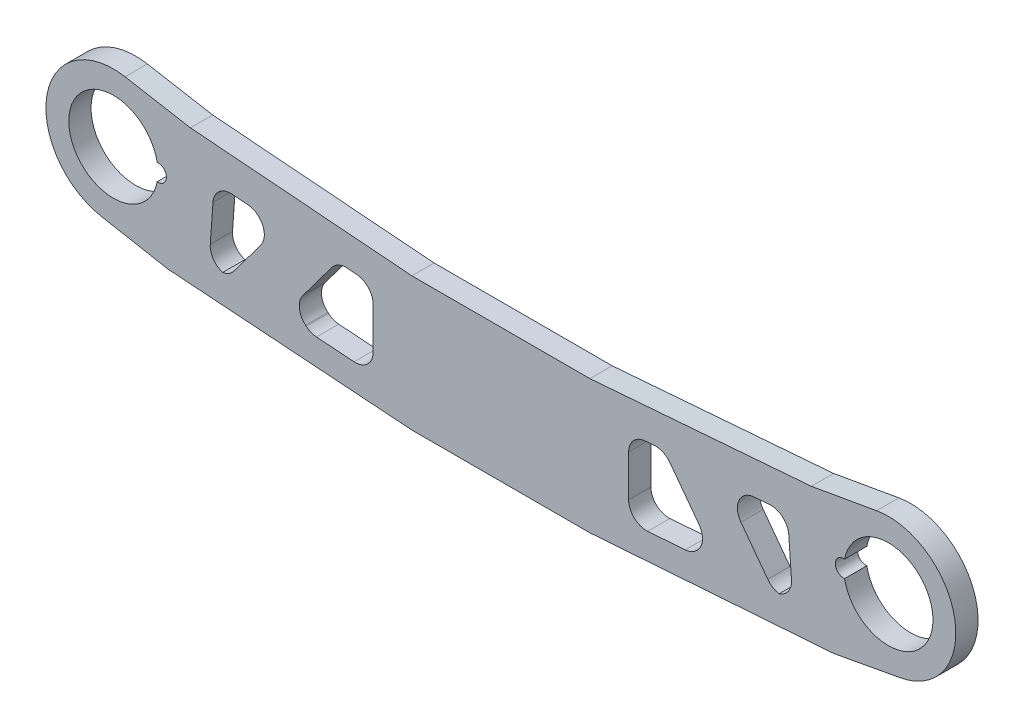
from build123d import *

# Parameters (mm, degrees)
Y_KSEKLIK_EKSTR_ZYON3_DEPTH = 5
KES_EKSTR_ZYON3_DEPTH       = 16
RADYUS1_R                   = 4
RADYUS1_OF_AYNALAMA1_R      = 4


with BuildPart() as part:
    # Çizim1 → Yükseklik-Ekstrüzyon3 (new body)
    with BuildSketch(Plane.XY):
        with BuildLine():
            Line((0, 14.764846508), (20, 14.764846508))
            Line((20, 14.764846508), (69.730204906, 18.686854932))
            Line((69.730204906, 18.686854932), (84.409297917, 21.275175082))
            ThreePointArc((84.409297917, 21.275175082), (101.971159912, 8.937394133), (89.578700393, -8.585926971))
            Line((89.578700393, -8.585926971), (74.828761414, -11.313435014))
            Line((74.828761414, -11.313435014), (20, -15.235443437))
            Line((20, -15.235443437), (0, -15.235443437))
            Line((0, -15.235443437), (0, 0))
            Line((0, 0), (0, 14.764846508))
        make_face()
    y_kseklik_ekstr_zyon3 = extrude(amount=Y_KSEKLIK_EKSTR_ZYON3_DEPTH)

    # Çizim2 → Kes-Ekstrüzyon3 (cut)
    with BuildSketch(Plane.XY):
        Polygon((28.695940883, -8.752311503), (42.731699056, -7.748306299), (46.735341753, -4.32569838), (36.65049886, 9.180616861), (28.695940883, 8.553274918), align=None)
        Polygon((49.583112015, 9.598582086), (61.257040732, -6.035946189), (65.565337221, -5.727765324), (64.37597588, 10.765231948), align=None)
        with BuildLine():
            ThreePointArc((77.201041987, 4.464811576), (97.059503272, 6.35268034), (77.201041987, 8.240549104))
            ThreePointArc((77.201041987, 8.240549104), (75.125188984, 6.35268034), (77.201041987, 4.464811576))
        make_face()
    kes_ekstr_zyon3 = extrude(amount=KES_EKSTR_ZYON3_DEPTH, mode=Mode.SUBTRACT)

    # Radyus1
    # the kernel refuses this fillet: 4 mm, written as the material it adds along each edge
    with BuildSketch(Plane(origin=(28.695940883, -8.752311503, 0), x_dir=(0, 1, 0), z_dir=(0, 0, 1))) as radyus1_piece_1:
        with BuildLine():
            CenterArc((RADYUS1_R * 1.07408709953, -RADYUS1_R), RADYUS1_R, 90, 94.091510037)
            Line((RADYUS1_R * 0.0766357332147, -RADYUS1_R * 1.07134964497), (0, 0))
            Line((0, 0), (RADYUS1_R * 1.07408709953, 0))
        make_face()
    extrude(amount=5)
    with BuildSketch(Plane(origin=(64.37597588, 10.765231948, 0), x_dir=(-0.9969045315308735, -0.0786215938099059, 0), z_dir=(0, 0, 1))) as radyus1_piece_2:
        with BuildLine():
            CenterArc((RADYUS1_R * 1.0067369642, RADYUS1_R), RADYUS1_R, 179.615297698, 90.384702302)
            Line((RADYUS1_R * 0.00675950517271, RADYUS1_R * 1.00671427137), (0, 0))
            Line((0, 0), (RADYUS1_R * 1.0067369642, 0))
        make_face()
    extrude(amount=5)
    with BuildSketch(Plane(origin=(49.583112015, 9.598582086, 0), x_dir=(0.9969045315308733, 0.07862159380990602, 0), z_dir=(0, 0, 1))) as radyus1_piece_3:
        with BuildLine():
            CenterArc((RADYUS1_R * 1.81293545135, -RADYUS1_R), RADYUS1_R, 90, 122.238478949)
            Line((RADYUS1_R * 0.967100347397, -RADYUS1_R * 1.53344444595), (0, 0))
            Line((0, 0), (RADYUS1_R * 1.81293545135, 0))
        make_face()
    extrude(amount=5)
    with BuildSketch(Plane(origin=(65.565337221, -5.727765324, 0), x_dir=(-0.07192633405101899, 0.9974099470478431, 0), z_dir=(0, 0, 1))) as radyus1_piece_4:
        with BuildLine():
            CenterArc((RADYUS1_R * 1.0005783418, RADYUS1_R), RADYUS1_R, 179.966873036, 90.033126964)
            Line((RADYUS1_R * 0.000578508947597, RADYUS1_R * 1.00057817457), (0, 0))
            Line((0, 0), (RADYUS1_R * 1.0005783418, 0))
        make_face()
    extrude(amount=5)
    with BuildSketch(Plane(origin=(46.735341753, -4.32569838, 0), x_dir=(-0.5982940894650627, 0.8012765955094231, 0), z_dir=(0, 0, 1))) as radyus1_piece_5:
        with BuildLine():
            CenterArc((RADYUS1_R * 0.936136482984, RADYUS1_R), RADYUS1_R, 183.778435906, 86.221564094)
            Line((-RADYUS1_R * 0.0616898577771, RADYUS1_R * 0.934101641269), (0, 0))
            Line((0, 0), (RADYUS1_R * 0.936136482984, 0))
        make_face()
    extrude(amount=5)
    with BuildSketch(Plane(origin=(36.65049886, 9.180616861, 0), x_dir=(-0.9969045315308735, -0.07862159380990552, 0), z_dir=(0, 0, 1))) as radyus1_piece_6:
        with BuildLine():
            CenterArc((RADYUS1_R * 0.551591618585, RADYUS1_R), RADYUS1_R, 212.238478949, 57.761521051)
            Line((-RADYUS1_R * 0.294243485369, RADYUS1_R * 0.466555554046), (0, 0))
            Line((0, 0), (RADYUS1_R * 0.551591618585, 0))
        make_face()
    extrude(amount=5)
    with BuildSketch(Plane(origin=(28.695940883, 8.553274918, 0), x_dir=(0, -1, 0), z_dir=(0, 0, 1))) as radyus1_piece_7:
        with BuildLine():
            CenterArc((RADYUS1_R * 0.924239359987, RADYUS1_R), RADYUS1_R, 184.509339304, 85.490660696)
            Line((-RADYUS1_R * 0.072665171544, RADYUS1_R * 0.92137840619), (0, 0))
            Line((0, 0), (RADYUS1_R * 0.924239359987, 0))
        make_face()
    extrude(amount=5)
    with BuildSketch(Plane(origin=(42.731699056, -7.748306299, 0), x_dir=(0.7601082947002393, 0.6497964145237292, 0), z_dir=(0, 0, 1))) as radyus1_piece_8:
        with BuildLine():
            CenterArc((RADYUS1_R * 0.32911927964, RADYUS1_R), RADYUS1_R, 233.565255877, 36.434744123)
            Line((-RADYUS1_R * 0.26478758489, RADYUS1_R * 0.195466199427), (0, 0))
            Line((0, 0), (RADYUS1_R * 0.32911927964, 0))
        make_face()
    extrude(amount=5)
    with BuildSketch(Plane(origin=(61.257040732, -6.035946189, 0), x_dir=(0.9974513663147319, 0.07134964496670383, 0), z_dir=(0, 0, 1))) as radyus1_piece_9:
        with BuildLine():
            CenterArc((RADYUS1_R * 0.546845511805, RADYUS1_R), RADYUS1_R, 212.656308216, 57.343691784)
            Line((-RADYUS1_R * 0.295076994051, RADYUS1_R * 0.460401543615), (0, 0))
            Line((0, 0), (RADYUS1_R * 0.546845511805, 0))
        make_face()
    extrude(amount=5)

    # Aynalama1: Yükseklik-Ekstrüzyon3, Kes-Ekstrüzyon3 across plane
    add(y_kseklik_ekstr_zyon3.mirror(Plane(origin=(0, 0, 5), x_dir=(0, 0, 1), z_dir=(1, 0, 0))))
    add(kes_ekstr_zyon3.mirror(Plane(origin=(0, 0, 5), x_dir=(0, 0, 1), z_dir=(1, 0, 0))), mode=Mode.SUBTRACT)

    # Radyus1 of Aynalama1
    # the kernel refuses this fillet: 4 mm, written as the material it adds along each edge
    with BuildSketch(Plane(origin=(-28.695940883, -8.752311503, 0), x_dir=(-0.9974513663147319, 0.07134964496670435, 0), z_dir=(0, 0, 1))) as radyus1_of_aynalama1_piece_1:
        with BuildLine():
            CenterArc((RADYUS1_OF_AYNALAMA1_R * 1.07408709953, -RADYUS1_OF_AYNALAMA1_R), RADYUS1_OF_AYNALAMA1_R, 90, 94.091510037)
            Line((RADYUS1_OF_AYNALAMA1_R * 0.0766357332147, -RADYUS1_OF_AYNALAMA1_R * 1.07134964497), (0, 0))
            Line((0, 0), (RADYUS1_OF_AYNALAMA1_R * 1.07408709953, 0))
        make_face()
    extrude(amount=5)
    with BuildSketch(Plane(origin=(-64.37597588, 10.765231948, 0), x_dir=(-0.07192633405101888, -0.9974099470478431, 0), z_dir=(0, 0, 1))) as radyus1_of_aynalama1_piece_2:
        with BuildLine():
            CenterArc((RADYUS1_OF_AYNALAMA1_R * 1.0067369642, RADYUS1_OF_AYNALAMA1_R), RADYUS1_OF_AYNALAMA1_R, 179.615297698, 90.384702302)
            Line((RADYUS1_OF_AYNALAMA1_R * 0.00675950517271, RADYUS1_OF_AYNALAMA1_R * 1.00671427137), (0, 0))
            Line((0, 0), (RADYUS1_OF_AYNALAMA1_R * 1.0067369642, 0))
        make_face()
    extrude(amount=5)
    with BuildSketch(Plane(origin=(-49.583112015, 9.598582086, 0), x_dir=(-0.5982940894650629, -0.801276595509423, 0), z_dir=(0, 0, 1))) as radyus1_of_aynalama1_piece_3:
        with BuildLine():
            CenterArc((RADYUS1_OF_AYNALAMA1_R * 1.81293545135, -RADYUS1_OF_AYNALAMA1_R), RADYUS1_OF_AYNALAMA1_R, 90, 122.238478949)
            Line((RADYUS1_OF_AYNALAMA1_R * 0.967100347397, -RADYUS1_OF_AYNALAMA1_R * 1.53344444595), (0, 0))
            Line((0, 0), (RADYUS1_OF_AYNALAMA1_R * 1.81293545135, 0))
        make_face()
    extrude(amount=5)
    with BuildSketch(Plane(origin=(-65.565337221, -5.727765324, 0), x_dir=(0.9974513663147317, -0.07134964496670429, 0), z_dir=(0, 0, 1))) as radyus1_of_aynalama1_piece_4:
        with BuildLine():
            CenterArc((RADYUS1_OF_AYNALAMA1_R * 1.0005783418, RADYUS1_OF_AYNALAMA1_R), RADYUS1_OF_AYNALAMA1_R, 179.966873036, 90.033126964)
            Line((RADYUS1_OF_AYNALAMA1_R * 0.000578508947597, RADYUS1_OF_AYNALAMA1_R * 1.00057817457), (0, 0))
            Line((0, 0), (RADYUS1_OF_AYNALAMA1_R * 1.0005783418, 0))
        make_face()
    extrude(amount=5)
    with BuildSketch(Plane(origin=(-46.735341753, -4.32569838, 0), x_dir=(0.7601082947002414, -0.6497964145237266, 0), z_dir=(0, 0, 1))) as radyus1_of_aynalama1_piece_5:
        with BuildLine():
            CenterArc((RADYUS1_OF_AYNALAMA1_R * 0.936136482984, RADYUS1_OF_AYNALAMA1_R), RADYUS1_OF_AYNALAMA1_R, 183.778435906, 86.221564094)
            Line((-RADYUS1_OF_AYNALAMA1_R * 0.0616898577771, RADYUS1_OF_AYNALAMA1_R * 0.934101641269), (0, 0))
            Line((0, 0), (RADYUS1_OF_AYNALAMA1_R * 0.936136482984, 0))
        make_face()
    extrude(amount=5)
    with BuildSketch(Plane(origin=(-36.65049886, 9.180616861, 0), x_dir=(-0.5982940894650631, -0.8012765955094229, 0), z_dir=(0, 0, 1))) as radyus1_of_aynalama1_piece_6:
        with BuildLine():
            CenterArc((RADYUS1_OF_AYNALAMA1_R * 0.551591618585, RADYUS1_OF_AYNALAMA1_R), RADYUS1_OF_AYNALAMA1_R, 212.238478949, 57.761521051)
            Line((-RADYUS1_OF_AYNALAMA1_R * 0.294243485369, RADYUS1_OF_AYNALAMA1_R * 0.466555554046), (0, 0))
            Line((0, 0), (RADYUS1_OF_AYNALAMA1_R * 0.551591618585, 0))
        make_face()
    extrude(amount=5)
    with BuildSketch(Plane(origin=(-28.695940883, 8.553274918, 0), x_dir=(-0.9969045315308733, 0.07862159380990529, 0), z_dir=(0, 0, 1))) as radyus1_of_aynalama1_piece_7:
        with BuildLine():
            CenterArc((RADYUS1_OF_AYNALAMA1_R * 0.924239359987, RADYUS1_OF_AYNALAMA1_R), RADYUS1_OF_AYNALAMA1_R, 184.509339304, 85.490660696)
            Line((-RADYUS1_OF_AYNALAMA1_R * 0.072665171544, RADYUS1_OF_AYNALAMA1_R * 0.92137840619), (0, 0))
            Line((0, 0), (RADYUS1_OF_AYNALAMA1_R * 0.924239359987, 0))
        make_face()
    extrude(amount=5)
    with BuildSketch(Plane(origin=(-42.731699056, -7.748306299, 0), x_dir=(0.9974513663147319, -0.07134964496670414, 0), z_dir=(0, 0, 1))) as radyus1_of_aynalama1_piece_8:
        with BuildLine():
            CenterArc((RADYUS1_OF_AYNALAMA1_R * 0.32911927964, RADYUS1_OF_AYNALAMA1_R), RADYUS1_OF_AYNALAMA1_R, 233.565255877, 36.434744123)
            Line((-RADYUS1_OF_AYNALAMA1_R * 0.26478758489, RADYUS1_OF_AYNALAMA1_R * 0.195466199427), (0, 0))
            Line((0, 0), (RADYUS1_OF_AYNALAMA1_R * 0.32911927964, 0))
        make_face()
    extrude(amount=5)
    with BuildSketch(Plane(origin=(-61.257040732, -6.035946189, 0), x_dir=(0.5982940894650642, 0.8012765955094219, 0), z_dir=(0, 0, 1))) as radyus1_of_aynalama1_piece_9:
        with BuildLine():
            CenterArc((RADYUS1_OF_AYNALAMA1_R * 0.546845511805, RADYUS1_OF_AYNALAMA1_R), RADYUS1_OF_AYNALAMA1_R, 212.656308216, 57.343691784)
            Line((-RADYUS1_OF_AYNALAMA1_R * 0.295076994051, RADYUS1_OF_AYNALAMA1_R * 0.460401543615), (0, 0))
            Line((0, 0), (RADYUS1_OF_AYNALAMA1_R * 0.546845511805, 0))
        make_face()
    extrude(amount=5)


solid = part.part
